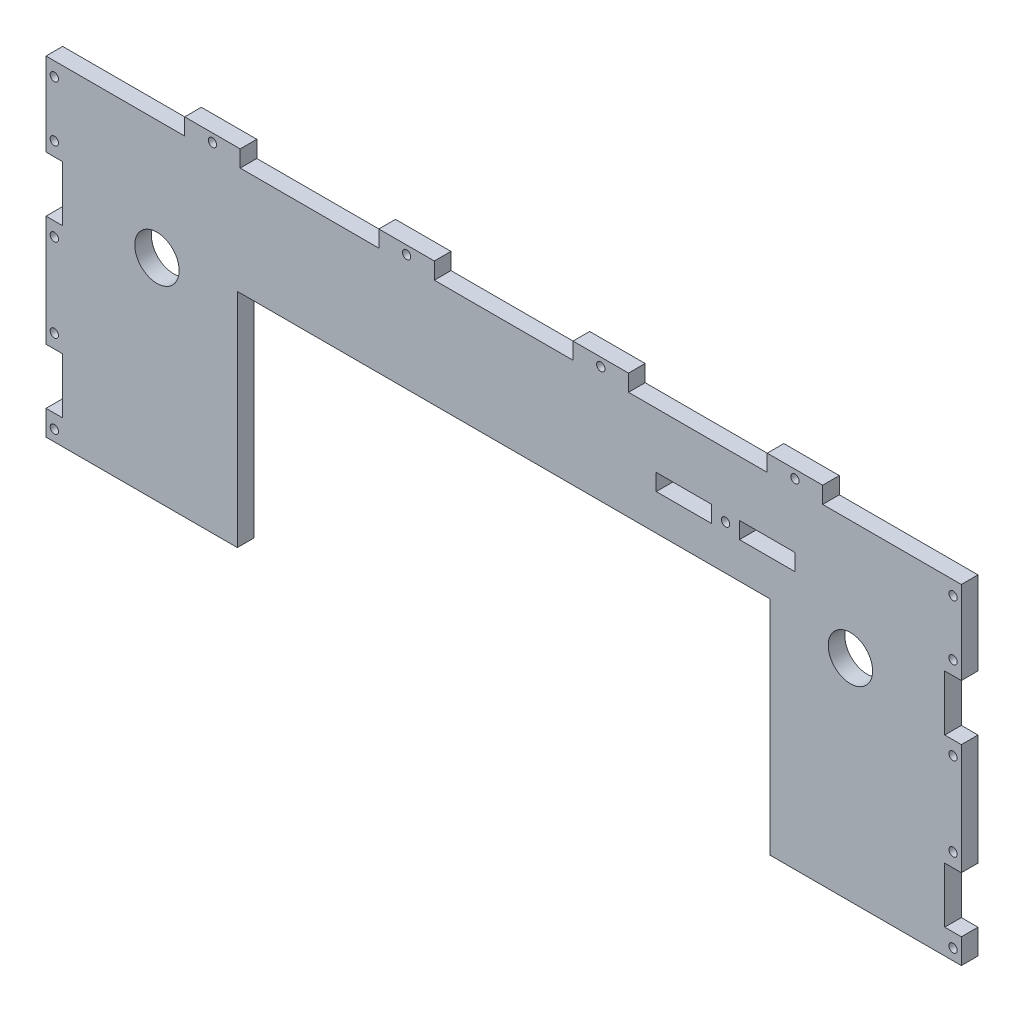
from build123d import *

# Parameters (mm, degrees)
ESQUISSE1_W             = 330
ESQUISSE1_H             = 238
ESQUISSE1_R             = 8
ESQUISSE1_W_2           = 15
ESQUISSE1_H_2           = 6
ESQUISSE1_W_3           = 20
BOSS_EXTRU_1_DEPTH      = 6
ESQUISSE2_W             = 20
ESQUISSE2_H             = 6
BOSS_EXTRU_2_DEPTH      = 6
ESQUISSE3_W             = 6
ESQUISSE3_H             = 20
ESQUISSE3_W_2           = 12
ESQUISSE3_H_2           = 10
ENL_V_MAT_EXTRU_1_DEPTH = 6
ESQUISSE4_R             = 1.5
ENL_V_MAT_EXTRU_2_DEPTH = 6
ESQUISSE5_W             = 423.604058921
ESQUISSE5_H             = 150.356061945
ENL_V_MAT_EXTRU_3_DEPTH = 6
ESQUISSE6_W             = 1.709615384
ESQUISSE6_H             = 19.05
ESQUISSE6_W_2           = 1.709615385
ENL_V_MAT_EXTRU_4_DEPTH = 6
ESQUISSE7_W             = 1.58262541
ESQUISSE7_H             = 1.953846154
ESQUISSE7_W_2           = 1.587980571
ESQUISSE7_H_2           = 1.936817114
ESQUISSE7_W_3           = 0.906225897
ESQUISSE7_W_4           = 1.709615385
ESQUISSE7_H_3           = 0.97063598
ESQUISSE7_W_5           = 1.216684544
ESQUISSE7_W_6           = 1.709615384
ESQUISSE7_H_4           = 3.052884616
ESQUISSE7_H_5           = 2.641773465
ESQUISSE7_W_7           = 1.710749653
ESQUISSE7_H_6           = 0.906659764
ESQUISSE7_W_8           = 1.70801118
ESQUISSE7_H_7           = 1.10546444
BOSS_EXTRU_5_DEPTH      = 6
ESQUISSE8_W             = 192.05
ESQUISSE8_H             = 80
ENL_V_MAT_EXTRU_5_DEPTH = 6


with BuildPart() as part:
    # Esquisse1 → Boss.-Extru.1 (new body)
    with BuildSketch(Plane.XY):
        Rectangle(ESQUISSE1_W, ESQUISSE1_H)
        with Locations((-125, 76)):
            Circle(ESQUISSE1_R, mode=Mode.SUBTRACT)
        with Locations((125, 76)):
            Circle(ESQUISSE1_R, mode=Mode.SUBTRACT)
        with Locations((-85, -58)):
            Rectangle(ESQUISSE1_W_2, ESQUISSE1_H_2, mode=Mode.SUBTRACT)
        with Locations((0, -58)):
            Rectangle(ESQUISSE1_W_2, ESQUISSE1_H_2, mode=Mode.SUBTRACT)
        with Locations((85, -58)):
            Rectangle(ESQUISSE1_W_2, ESQUISSE1_H_2, mode=Mode.SUBTRACT)
        with Locations((65, 96)):
            Rectangle(ESQUISSE1_W_3, ESQUISSE1_H_2, mode=Mode.SUBTRACT)
        with Locations((95, 96)):
            Rectangle(ESQUISSE1_W_3, ESQUISSE1_H_2, mode=Mode.SUBTRACT)
    extrude(amount=BOSS_EXTRU_1_DEPTH)

    # Esquisse2 → Boss.-Extru.2 (add)
    with BuildSketch(Plane.XY.offset(6)):
        with Locations((-105, 122)):
            Rectangle(ESQUISSE2_W, ESQUISSE2_H)
        with Locations((105, 122)):
            Rectangle(ESQUISSE2_W, ESQUISSE2_H)
        with Locations((35, 122)):
            Rectangle(ESQUISSE2_W, ESQUISSE2_H)
        with Locations((-35, 122)):
            Rectangle(ESQUISSE2_W, ESQUISSE2_H)
        with Locations((105, -122)):
            Rectangle(ESQUISSE2_W, ESQUISSE2_H)
        with Locations((-105, -122)):
            Rectangle(ESQUISSE2_W, ESQUISSE2_H)
        with Locations((-35, -122)):
            Rectangle(ESQUISSE2_W, ESQUISSE2_H)
        with Locations((35, -122)):
            Rectangle(ESQUISSE2_W, ESQUISSE2_H)
    extrude(amount=-BOSS_EXTRU_2_DEPTH)

    # Esquisse3 → Enlèv. mat.-Extru.1 (cut)
    with BuildSketch(Plane.XY.offset(6)):
        with Locations((-162, 79)):
            Rectangle(ESQUISSE3_W, ESQUISSE3_H)
        with Locations((-162, 19)):
            Rectangle(ESQUISSE3_W, ESQUISSE3_H)
        with Locations((-162, -19)):
            Rectangle(ESQUISSE3_W, ESQUISSE3_H)
        with Locations((-162, -79)):
            Rectangle(ESQUISSE3_W, ESQUISSE3_H)
        with Locations((162, -79)):
            Rectangle(ESQUISSE3_W, ESQUISSE3_H)
        with Locations((162, -19)):
            Rectangle(ESQUISSE3_W, ESQUISSE3_H)
        with Locations((162, 19)):
            Rectangle(ESQUISSE3_W, ESQUISSE3_H)
        with Locations((162, 79)):
            Rectangle(ESQUISSE3_W, ESQUISSE3_H)
        with Locations((159, -114)):
            Rectangle(ESQUISSE3_W_2, ESQUISSE3_H_2)
        with Locations((-159, -114)):
            Rectangle(ESQUISSE3_W_2, ESQUISSE3_H_2)
    extrude(amount=-ENL_V_MAT_EXTRU_1_DEPTH, mode=Mode.SUBTRACT)

    # Esquisse4 → Enlèv. mat.-Extru.2 (cut)
    with BuildSketch(Plane.XY.offset(6)):
        with Locations((-162, 114)):
            Circle(ESQUISSE4_R)
        with Locations((-162, 94)):
            Circle(ESQUISSE4_R)
        with Locations((-162, 64)):
            Circle(ESQUISSE4_R)
        with Locations((-162, 34)):
            Circle(ESQUISSE4_R)
        with Locations((-162, 4)):
            Circle(ESQUISSE4_R)
        with Locations((-105, 122)):
            Circle(ESQUISSE4_R)
        with Locations((-162, -4)):
            Circle(ESQUISSE4_R)
        with Locations((-162, -34)):
            Circle(ESQUISSE4_R)
        with Locations((-162, -64)):
            Circle(ESQUISSE4_R)
        with Locations((-162, -94)):
            Circle(ESQUISSE4_R)
        with Locations((-97.5, -58)):
            Circle(ESQUISSE4_R)
        with Locations((-72.5, -58)):
            Circle(ESQUISSE4_R)
        with Locations((162, -94)):
            Circle(ESQUISSE4_R)
        with Locations((162, -64)):
            Circle(ESQUISSE4_R)
        with Locations((162, -34)):
            Circle(ESQUISSE4_R)
        with Locations((162, -4)):
            Circle(ESQUISSE4_R)
        with Locations((80, 96)):
            Circle(ESQUISSE4_R)
        with Locations((162, 4)):
            Circle(ESQUISSE4_R)
        with Locations((162, 34)):
            Circle(ESQUISSE4_R)
        with Locations((162, 64)):
            Circle(ESQUISSE4_R)
        with Locations((162, 94)):
            Circle(ESQUISSE4_R)
        with Locations((162, 114)):
            Circle(ESQUISSE4_R)
        with Locations((-12.5, -58)):
            Circle(ESQUISSE4_R)
        with Locations((12.5, -58)):
            Circle(ESQUISSE4_R)
        with Locations((72.5, -58)):
            Circle(ESQUISSE4_R)
        with Locations((97.5, -58)):
            Circle(ESQUISSE4_R)
        with Locations((-35, 122)):
            Circle(ESQUISSE4_R)
        with Locations((35, 122)):
            Circle(ESQUISSE4_R)
        with Locations((105, 122)):
            Circle(ESQUISSE4_R)
    extrude(amount=-ENL_V_MAT_EXTRU_2_DEPTH, mode=Mode.SUBTRACT)

    # Esquisse5 → Enlèv. mat.-Extru.3 (cut)
    with BuildSketch(Plane.XY.offset(6)):
        with Locations((11.705214191, -75.178030973)):
            Rectangle(ESQUISSE5_W, ESQUISSE5_H)
    extrude(amount=-ENL_V_MAT_EXTRU_3_DEPTH, mode=Mode.SUBTRACT)

    # Esquisse6 → Enlèv. mat.-Extru.4 (cut)
    # profile 1 of 11: a face of its own
    with BuildSketch(Plane.XY.offset(6)):
        with BuildLine():
            Line((-81.011538462, 33.174909856), (-79.401141827, 34.140384615))
            add(Edge.make_bspline(
                [(-79.401141827, 34.140384615), (-79.251363993, 33.889662749), (-78.964395442, 33.409289328), (-78.485688759, 32.760184851), (-77.989665343, 32.208485112), (-77.47265197, 31.757399576), (-76.937804452, 31.402259207), (-76.381631246, 31.15078706), (-75.80600659, 30.993945823), (-75.414263362, 30.974895352), (-75.218689904, 30.965384615)],
                knots=[0, 0, 0, 0, 1.272034388, 2.437168799, 3.508375237, 4.49857839, 5.41946034, 6.295179144, 7.148887113, 8, 8, 8, 8], degree=3))
            add(Edge.make_bspline(
                [(-75.218689904, 30.965384615), (-75.051665706, 30.970036476), (-74.720539841, 30.9792588), (-74.233065347, 31.06787288), (-73.759635824, 31.204010324), (-73.31000881, 31.398978537), (-72.890388393, 31.634863724), (-72.522414809, 31.91977649), (-72.204300964, 32.238761695), (-71.944082784, 32.594630144), (-71.744438591, 32.977356339), (-71.59099319, 33.370199731), (-71.50583929, 33.77933151), (-71.493011817, 34.054797029), (-71.486538462, 34.193810096)],
                knots=[0, 0, 0, 0, 1.095163259, 2.171163733, 3.241058638, 4.321873601, 5.38011039, 6.391990106, 7.366004449, 8.327778327, 9.272591725, 10.192022065, 11.087607919, 12, 12, 12, 12], degree=3))
            add(Edge.make_bspline(
                [(-71.486538462, 34.193810096), (-71.494562924, 34.352419578), (-71.510875484, 34.674849478), (-71.648751111, 35.150553303), (-71.865644869, 35.621320006), (-72.065738687, 35.912519751), (-72.169621394, 36.063701923)],
                knots=[0, 0, 0, 0, 0.938893495, 1.908633276, 2.914225137, 4, 4, 4, 4], degree=3))
            add(Edge.make_bspline(
                [(-72.169621394, 36.063701923), (-72.254914309, 36.17281392), (-72.433976113, 36.401880909), (-72.741810575, 36.742849977), (-73.103031854, 37.0945588), (-73.505278346, 37.470437381), (-73.963202729, 37.853003818), (-74.462462486, 38.260501159), (-75.015804347, 38.6774326), (-75.403877322, 38.957046135), (-75.604116587, 39.101322115)],
                knots=[0, 0, 0, 0, 0.722233717, 1.516239348, 2.393582979, 3.351407094, 4.387010283, 5.505090956, 6.712668013, 8, 8, 8, 8], degree=3))
            add(Edge.make_bspline(
                [(-75.604116587, 39.101322115), (-75.804544337, 39.244080571), (-76.187746934, 39.517023867), (-76.723642932, 39.922104613), (-77.202856367, 40.292457674), (-77.623257299, 40.631569511), (-77.984660819, 40.939486117), (-78.289914814, 41.213250614), (-78.531243246, 41.460266853), (-78.665440049, 41.62051187), (-78.725691106, 41.692457933)],
                knots=[0, 0, 0, 0, 1.452282411, 2.77665338, 3.964542531, 5.026858415, 5.96415736, 6.766646006, 7.446254459, 8, 8, 8, 8], degree=3))
            add(Edge.make_bspline(
                [(-78.725691106, 41.692457933), (-78.809905959, 41.804586433), (-78.97552577, 42.025102178), (-79.1941436, 42.369770333), (-79.379958186, 42.722594106), (-79.525621737, 43.084521597), (-79.648283157, 43.45047171), (-79.730785608, 43.825219204), (-79.782445925, 44.207082542), (-79.787736309, 44.464058881), (-79.790384615, 44.592698317)],
                knots=[0, 0, 0, 0, 1.068054152, 2.10047183, 3.106115577, 4.101338837, 5.06977816, 6.043150881, 7.020423561, 8, 8, 8, 8], degree=3))
            add(Edge.make_bspline(
                [(-79.790384615, 44.592698317), (-79.783280549, 44.79424609), (-79.769224262, 45.193033694), (-79.650349446, 45.775587214), (-79.462718411, 46.331773285), (-79.199856235, 46.85608553), (-78.860998357, 47.334871798), (-78.468862411, 47.773639491), (-78.00180275, 48.142494203), (-77.489343472, 48.464776978), (-76.928422361, 48.717031228), (-76.340643301, 48.907318848), (-75.725072095, 49.015137808), (-75.308132177, 49.030610571), (-75.096574519, 49.038461538)],
                knots=[0, 0, 0, 0, 1.005424448, 1.989358655, 2.955360095, 3.929531133, 4.905563448, 5.876582895, 6.856512386, 7.866279853, 8.892233794, 9.918561126, 10.94386622, 12, 12, 12, 12], degree=3))
            add(Edge.make_bspline(
                [(-75.096574519, 49.038461538), (-74.872088773, 49.030718793), (-74.425658273, 49.015320944), (-73.768981828, 48.881440095), (-73.136735643, 48.659912153), (-72.628137302, 48.408513886), (-72.230086129, 48.157427181), (-71.926523112, 47.92871928), (-71.618906702, 47.665420475), (-71.304755575, 47.366829435), (-70.989392843, 47.030206404), (-70.668136624, 46.657856798), (-70.340235675, 46.252056115), (-70.129293065, 45.962362761), (-70.021153846, 45.813852163)],
                knots=[0, 0, 0, 0, 1.286793592, 2.559021753, 3.825965368, 5.121522368, 5.803751409, 6.523245864, 7.299691795, 8.125521123, 9.008227632, 9.944561021, 10.946284179, 12, 12, 12, 12], degree=3))
            Line((-70.021153846, 45.813852163), (-71.566676683, 44.642307692))
            add(Edge.make_bspline(
                [(-71.566676683, 44.642307692), (-71.659999544, 44.762533279), (-71.839717554, 44.994059648), (-72.11256519, 45.318297809), (-72.369732831, 45.614478933), (-72.623100007, 45.871736273), (-72.859285344, 46.104157885), (-73.088522388, 46.303147418), (-73.307512214, 46.470654588), (-73.583557113, 46.649417392), (-73.930363552, 46.82661779), (-74.365707956, 46.976563487), (-74.82065611, 47.066670324), (-75.130515962, 47.078584126), (-75.287379808, 47.084615385)],
                knots=[0, 0, 0, 0, 1.181633172, 2.275549214, 3.290209073, 4.226197932, 5.078386478, 5.862611352, 6.581680152, 7.217281963, 8.414376989, 9.595101626, 10.782541182, 12, 12, 12, 12], degree=3))
            add(Edge.make_bspline(
                [(-75.287379808, 47.084615385), (-75.484174594, 47.078020275), (-75.863674801, 47.065302227), (-76.402464514, 46.926400593), (-76.887390021, 46.707696467), (-77.304054696, 46.401182087), (-77.650965957, 46.038029255), (-77.901911383, 45.620132915), (-78.052951564, 45.15867441), (-78.0713826, 44.836774823), (-78.080769231, 44.672836538)],
                knots=[0, 0, 0, 0, 1.14458467, 2.207223713, 3.21896685, 4.227309161, 5.202851033, 6.127160689, 7.046193047, 8, 8, 8, 8], degree=3))
            add(Edge.make_bspline(
                [(-78.080769231, 44.672836538), (-78.078629499, 44.57077492), (-78.074346536, 44.366484791), (-78.01461228, 44.064670623), (-77.937871646, 43.763618904), (-77.816263893, 43.464683132), (-77.648377312, 43.162635263), (-77.427913426, 42.852274092), (-77.150255256, 42.530864077), (-76.937564661, 42.321818229), (-76.825270433, 42.211448317)],
                knots=[0, 0, 0, 0, 0.858281714, 1.717966888, 2.583508476, 3.4729293, 4.427298488, 5.488583878, 6.674047936, 8, 8, 8, 8], degree=3))
            add(Edge.make_bspline(
                [(-76.825270433, 42.211448317), (-76.783570677, 42.174235363), (-76.684501603, 42.0858259), (-76.503385493, 41.941087915), (-76.26421112, 41.762547112), (-75.973223996, 41.541636147), (-75.625058785, 41.285378474), (-75.2196772, 40.997050671), (-74.761598, 40.667292672), (-74.436540144, 40.43674663), (-74.264663462, 40.31484375)],
                knots=[0, 0, 0, 0, 0.420754252, 0.999615792, 1.744751191, 2.668019286, 3.750313428, 4.999500688, 6.413464383, 8, 8, 8, 8], degree=3))
            add(Edge.make_bspline(
                [(-74.264663462, 40.31484375), (-74.057911562, 40.164395779), (-73.657565164, 39.873074134), (-73.087928907, 39.435383076), (-72.571435466, 39.007314507), (-72.106271458, 38.591602102), (-71.687841428, 38.191399196), (-71.320787548, 37.801891029), (-71.001369774, 37.425868126), (-70.657494313, 36.94378025), (-70.306115324, 36.351700348), (-70.004355119, 35.626285936), (-69.814081828, 34.898051677), (-69.789199723, 34.408592753), (-69.776923077, 34.167097356)],
                knots=[0, 0, 0, 0, 1.163667725, 2.253281268, 3.268753668, 4.215851969, 5.092017293, 5.902905408, 6.650798638, 7.335211899, 8.59617414, 9.77448103, 10.901945474, 12, 12, 12, 12], degree=3))
            add(Edge.make_bspline(
                [(-69.776923077, 34.167097356), (-69.780499786, 33.996309397), (-69.787583746, 33.658050067), (-69.869013863, 33.16136172), (-69.988319469, 32.678956558), (-70.168136414, 32.216797503), (-70.387609604, 31.76642958), (-70.666100181, 31.339666579), (-70.988903437, 30.927063181), (-71.3592015, 30.539621607), (-71.764399911, 30.183951597), (-72.192664021, 29.86756342), (-72.644694792, 29.60375726), (-73.11804003, 29.388487677), (-73.612808463, 29.22012096), (-74.128833686, 29.098130915), (-74.666966312, 29.023260545), (-75.032728933, 29.015489444), (-75.218689904, 29.011538462)],
                knots=[0, 0, 0, 0, 0.983748083, 1.948392443, 2.894712957, 3.844097841, 4.80183111, 5.778335162, 6.776009319, 7.81870978, 8.863265674, 9.881300176, 10.883814829, 11.87499822, 12.874611388, 13.892143829, 14.928324115, 16, 16, 16, 16], degree=3))
            add(Edge.make_bspline(
                [(-75.218689904, 29.011538462), (-75.362573699, 29.01432075), (-75.648529222, 29.019850287), (-76.07149083, 29.068734113), (-76.485907737, 29.137897063), (-76.886579758, 29.247701643), (-77.278669098, 29.380926333), (-77.660470475, 29.544964972), (-78.032168925, 29.741545739), (-78.395847483, 29.966308659), (-78.750581205, 30.227880098), (-79.093042881, 30.532535842), (-79.434468876, 30.87187352), (-79.764781705, 31.255108157), (-80.090662676, 31.676048294), (-80.40568659, 32.138632278), (-80.716374225, 32.640340446), (-80.9113127, 32.993391841), (-81.011538462, 33.174909856)],
                knots=[0, 0, 0, 0, 0.915332311, 1.819136955, 2.706846663, 3.586547465, 4.459518054, 5.340707479, 6.227863349, 7.133153174, 8.059268498, 9.028702269, 10.047606654, 11.120612155, 12.245963614, 13.433783089, 14.680604001, 16, 16, 16, 16], degree=3))
        make_face()
    # profile 2 of 11: a face of its own
    with BuildSketch(Plane.XY.offset(6)):
        with BuildLine():
            Line((-65.869230769, 48.55), (-64.159615385, 48.55))
            Line((-64.159615385, 48.55), (-64.159615385, 37.136027644))
            add(Edge.make_bspline(
                [(-64.159615385, 37.136027644), (-64.159869805, 36.97447964), (-64.160352613, 36.667914462), (-64.157127644, 36.231569854), (-64.148095939, 35.843644041), (-64.142401842, 35.502641707), (-64.129734498, 35.21012761), (-64.1194037, 34.96451699), (-64.106120098, 34.766972831), (-64.090155559, 34.651688077), (-64.083293269, 34.602133413)],
                knots=[0, 0, 0, 0, 1.528628734, 2.90083645, 4.128790002, 5.200304208, 6.127813768, 6.898992206, 7.526736466, 8, 8, 8, 8], degree=3))
            add(Edge.make_bspline(
                [(-64.083293269, 34.602133413), (-64.055113101, 34.423353173), (-64.000340615, 34.075866319), (-63.860751044, 33.581065527), (-63.665801503, 33.135124305), (-63.434790085, 32.724127134), (-63.130356872, 32.359513618), (-62.765666201, 32.023625907), (-62.323827204, 31.729865085), (-61.832551622, 31.461255666), (-61.303041972, 31.245364289), (-60.761960651, 31.082114692), (-60.217441007, 30.982625252), (-59.852899308, 30.971105233), (-59.671875, 30.965384615)],
                knots=[0, 0, 0, 0, 1.035780045, 2.013197591, 2.933192213, 3.817615948, 4.702609284, 5.640816605, 6.646850145, 7.73207398, 8.84249596, 9.914020372, 10.964143139, 12, 12, 12, 12], degree=3))
            add(Edge.make_bspline(
                [(-59.671875, 30.965384615), (-59.51646107, 30.971229429), (-59.20653084, 30.982885298), (-58.746030125, 31.055065373), (-58.297538105, 31.185152738), (-57.858840118, 31.353009137), (-57.447626903, 31.574792454), (-57.063669026, 31.830992309), (-56.720965327, 32.13149722), (-56.408229653, 32.464057667), (-56.135896645, 32.839287149), (-55.899833717, 33.249015301), (-55.706471157, 33.699408174), (-55.610984258, 34.015934387), (-55.561929087, 34.178545673)],
                knots=[0, 0, 0, 0, 0.994687771, 1.983630487, 2.973142513, 3.978332533, 4.983357753, 5.956394766, 6.925816176, 7.893390482, 8.871859704, 9.88551698, 10.913711441, 12, 12, 12, 12], degree=3))
            add(Edge.make_bspline(
                [(-55.561929087, 34.178545673), (-55.545599833, 34.245757199), (-55.509211676, 34.395531565), (-55.475209903, 34.648740304), (-55.439795814, 34.947495271), (-55.415223655, 35.293942995), (-55.391268441, 35.686922574), (-55.376937002, 36.128481204), (-55.370312865, 36.617015519), (-55.368338848, 36.957940643), (-55.367307692, 37.136027644)],
                knots=[0, 0, 0, 0, 0.558680831, 1.244966039, 2.062412453, 2.990489873, 4.051219941, 5.244515665, 6.560634259, 8, 8, 8, 8], degree=3))
            Line((-55.367307692, 37.136027644), (-55.367307692, 48.55))
            Line((-55.367307692, 48.55), (-53.657692308, 48.55))
            Line((-53.657692308, 48.55), (-53.657692308, 37.044441106))
            add(Edge.make_bspline(
                [(-53.657692308, 37.044441106), (-53.659075449, 36.837077072), (-53.661774732, 36.432393552), (-53.685182156, 35.839386869), (-53.722503826, 35.276851356), (-53.775234705, 34.744711397), (-53.84510468, 34.244871187), (-53.922802666, 33.77294952), (-54.021751267, 33.332333946), (-54.137321636, 32.91958893), (-54.269439091, 32.526693493), (-54.440568769, 32.15381089), (-54.633379262, 31.789605372), (-54.862059016, 31.439585522), (-55.119023827, 31.102201569), (-55.409953689, 30.779499603), (-55.725226622, 30.466322794), (-56.070083654, 30.170704534), (-56.438840084, 29.899603022), (-56.830398996, 29.66121801), (-57.241752557, 29.45970375), (-57.671831487, 29.293827647), (-58.12081932, 29.169106757), (-58.588727377, 29.076169123), (-59.076620701, 29.023360904), (-59.408442616, 29.015512684), (-59.576472356, 29.011538462)],
                knots=[0, 0, 0, 0, 1.316592851, 2.569410997, 3.76748051, 4.895814652, 5.963796859, 6.97159953, 7.931736103, 8.829262218, 9.692595152, 10.560224239, 11.431080259, 12.30701507, 13.211635791, 14.121146779, 15.063487852, 16.031507147, 17.00238618, 17.966455255, 18.938106653, 19.907068911, 20.888905087, 21.893141452, 22.933117798, 24, 24, 24, 24], degree=3))
            add(Edge.make_bspline(
                [(-59.576472356, 29.011538462), (-59.759728471, 29.015809827), (-60.119276315, 29.02419023), (-60.649073509, 29.072211199), (-61.156969349, 29.162662745), (-61.648328051, 29.277833296), (-62.116460014, 29.436676209), (-62.56763719, 29.622267431), (-62.994132297, 29.850199376), (-63.402864355, 30.103800558), (-63.782910527, 30.389140375), (-64.131783536, 30.700146179), (-64.450059346, 31.031835947), (-64.73237325, 31.387800795), (-64.983402636, 31.765272229), (-65.199648512, 32.165318091), (-65.385322026, 32.587783498), (-65.481152056, 32.88144306), (-65.529597356, 33.029897837)],
                knots=[0, 0, 0, 0, 1.13879206, 2.234305948, 3.301075583, 4.341971843, 5.366689343, 6.369221514, 7.369726634, 8.367512178, 9.355451585, 10.318319045, 11.268648973, 12.207971039, 13.137398894, 14.081662264, 15.030215811, 16, 16, 16, 16], degree=3))
            add(Edge.make_bspline(
                [(-65.529597356, 33.029897837), (-65.557775888, 33.131312277), (-65.618895752, 33.351282458), (-65.68434773, 33.71533606), (-65.739370017, 34.134517255), (-65.791107412, 34.608854735), (-65.821636169, 35.138716152), (-65.848401085, 35.723871822), (-65.869419325, 36.3650293), (-65.869295378, 36.811640306), (-65.869230769, 37.044441106)],
                knots=[0, 0, 0, 0, 0.625038921, 1.35572334, 2.194682327, 3.136881307, 4.189498639, 5.346923369, 6.617055217, 8, 8, 8, 8], degree=3))
            Line((-65.869230769, 37.044441106), (-65.869230769, 48.55))
        make_face()
    # profile 3 of 11: a face of its own
    with BuildSketch(Plane.XY.offset(6)):
        with BuildLine():
            Line((-48.773076923, 29.5), (-48.773076923, 48.55))
            Line((-48.773076923, 48.55), (-44.926442308, 48.55))
            add(Edge.make_bspline(
                [(-44.926442308, 48.55), (-44.591875386, 48.547591155), (-43.945493835, 48.542937278), (-43.0114318, 48.513429421), (-42.147194464, 48.461229885), (-41.355624188, 48.38519575), (-40.634547877, 48.291834239), (-39.985984596, 48.174810609), (-39.406580789, 48.036626425), (-39.050239977, 47.918813331), (-38.881730769, 47.863100962)],
                knots=[0, 0, 0, 0, 1.314313732, 2.53924729, 3.670748893, 4.714932338, 5.66265055, 6.526160246, 7.303039223, 8, 8, 8, 8], degree=3))
            add(Edge.make_bspline(
                [(-38.881730769, 47.863100962), (-38.661323688, 47.779113835), (-38.225507627, 47.613044132), (-37.604983146, 47.299773406), (-37.020826527, 46.944827809), (-36.469905182, 46.547739471), (-35.964803541, 46.097264945), (-35.485789132, 45.612539951), (-35.052457563, 45.075937699), (-34.655628124, 44.498586693), (-34.29783832, 43.887288237), (-33.986838047, 43.243207146), (-33.72855274, 42.569614342), (-33.514141035, 41.868383036), (-33.345159602, 41.137971323), (-33.229869374, 40.377528709), (-33.153827272, 39.59006055), (-33.146185221, 39.055710968), (-33.142307692, 38.784585337)],
                knots=[0, 0, 0, 0, 0.984719456, 1.947108742, 2.898477687, 3.838006223, 4.779231079, 5.722358779, 6.681677486, 7.655904652, 8.64651281, 9.637519902, 10.640069247, 11.656948941, 12.698408672, 13.768548281, 14.867775369, 16, 16, 16, 16], degree=3))
            add(Edge.make_bspline(
                [(-33.142307692, 38.784585337), (-33.145731072, 38.549120596), (-33.152477201, 38.08511273), (-33.213052477, 37.401267284), (-33.301097876, 36.737709131), (-33.437409867, 36.097598107), (-33.602886405, 35.47532595), (-33.814962714, 34.877524734), (-34.057907343, 34.298710572), (-34.341207396, 33.746709738), (-34.652219792, 33.223741669), (-34.98598528, 32.730752009), (-35.342147865, 32.274775444), (-35.72410381, 31.854431142), (-36.126917238, 31.470352779), (-36.55322538, 31.119331953), (-37.00412827, 30.80823699), (-37.477606347, 30.524843158), (-37.987472136, 30.277626652), (-38.543383065, 30.068457598), (-39.147709905, 29.895121021), (-39.798969299, 29.750499431), (-40.498286514, 29.635778683), (-41.246347171, 29.558890747), (-42.042001933, 29.506895499), (-42.588351934, 29.50234313), (-42.869561298, 29.5)],
                knots=[0, 0, 0, 0, 1.105936401, 2.179363191, 3.223086493, 4.248585256, 5.251745608, 6.245858792, 7.225916811, 8.198733463, 9.158002045, 10.082870192, 10.993790845, 11.873723703, 12.748670949, 13.606408763, 14.465103618, 15.319838547, 16.196477973, 17.123216899, 18.106603292, 19.147568657, 20.255746949, 21.433717677, 22.679120308, 24, 24, 24, 24], degree=3))
            Line((-42.869561298, 29.5), (-48.773076923, 29.5))
        make_face()
        with BuildLine():
            Line((-47.063461538, 31.453846154), (-44.876832933, 31.453846154))
            add(Edge.make_bspline(
                [(-44.876832933, 31.453846154), (-44.562625658, 31.455196507), (-43.958289998, 31.457793731), (-43.089294327, 31.480584079), (-42.295293612, 31.517823767), (-41.576175111, 31.569939548), (-40.93234485, 31.638893011), (-40.362457297, 31.715772839), (-39.868380534, 31.811553249), (-39.569407455, 31.898372042), (-39.43125, 31.938491587)],
                knots=[0, 0, 0, 0, 1.375205317, 2.645023457, 3.804390687, 4.853969522, 5.800190428, 6.637939096, 7.370582563, 8, 8, 8, 8], degree=3))
            add(Edge.make_bspline(
                [(-39.43125, 31.938491587), (-39.257359629, 31.999732211), (-38.913732256, 32.120750728), (-38.419079492, 32.341500284), (-37.957759224, 32.602986406), (-37.5217318, 32.893647355), (-37.117182433, 33.22373488), (-36.739316886, 33.586071262), (-36.388895938, 33.982500538), (-36.069540062, 34.412530674), (-35.783744864, 34.873485133), (-35.536251458, 35.360832214), (-35.319345265, 35.869232138), (-35.149100354, 36.406491987), (-35.015665531, 36.967808719), (-34.921152016, 37.553221823), (-34.862289015, 38.162621971), (-34.855423134, 38.577107105), (-34.851923077, 38.788401442)],
                knots=[0, 0, 0, 0, 0.998632004, 1.973411704, 2.929992603, 3.868527914, 4.809262121, 5.754881198, 6.702106254, 7.672490631, 8.653608572, 9.636854334, 10.631411391, 11.644891563, 12.686317036, 13.754757253, 14.855430412, 16, 16, 16, 16], degree=3))
            add(Edge.make_bspline(
                [(-34.851923077, 38.788401442), (-34.854716827, 39.011196528), (-34.860205173, 39.448879446), (-34.929189634, 40.091085944), (-35.029999815, 40.708744914), (-35.175779591, 41.301897663), (-35.361549089, 41.871701408), (-35.593385639, 42.415004742), (-35.858271096, 42.937545529), (-36.173430686, 43.427263148), (-36.518592701, 43.890412785), (-36.901649445, 44.314710254), (-37.316515112, 44.701122088), (-37.758664792, 45.055666061), (-38.240559575, 45.364078354), (-38.750847521, 45.639958718), (-39.297014674, 45.87408807), (-39.676995204, 45.998614451), (-39.870102163, 46.061899038)],
                knots=[0, 0, 0, 0, 1.122418816, 2.205001699, 3.251619955, 4.274784885, 5.280384055, 6.268708349, 7.249350384, 8.229342522, 9.199999885, 10.157847722, 11.105861043, 12.055065948, 13.010012805, 13.98527497, 14.976112212, 16, 16, 16, 16], degree=3))
            add(Edge.make_bspline(
                [(-39.870102163, 46.061899038), (-40.02985626, 46.106075596), (-40.369537302, 46.200007078), (-40.923834956, 46.302470891), (-41.54766884, 46.392846807), (-42.243808642, 46.469362707), (-43.011460827, 46.524266556), (-43.851215786, 46.56547614), (-44.763436491, 46.593270811), (-45.395801425, 46.595168774), (-45.724008413, 46.596153846)],
                knots=[0, 0, 0, 0, 0.674548936, 1.434276114, 2.292660221, 3.240891867, 4.284742987, 5.42552168, 6.663806718, 8, 8, 8, 8], degree=3))
            Line((-45.724008413, 46.596153846), (-47.063461538, 46.596153846))
            Line((-47.063461538, 46.596153846), (-47.063461538, 31.453846154))
        make_face(mode=Mode.SUBTRACT)
    # profile 4 of 11: a face of its own
    with BuildSketch(Plane.XY.offset(6)):
        with BuildLine():
            Line((-29.234615385, 48.55), (-25.422325721, 48.55))
            add(Edge.make_bspline(
                [(-25.422325721, 48.55), (-25.167920436, 48.549153168), (-24.679434107, 48.547527156), (-23.979628164, 48.538460646), (-23.343754965, 48.51247451), (-22.772146982, 48.490112077), (-22.264814703, 48.449334511), (-21.820202449, 48.410360132), (-21.440357981, 48.359340635), (-21.210419848, 48.311958262), (-21.106310096, 48.290504808)],
                knots=[0, 0, 0, 0, 1.410062039, 2.707475311, 3.878576406, 4.937260626, 5.877586885, 6.699081471, 7.410979367, 8, 8, 8, 8], degree=3))
            add(Edge.make_bspline(
                [(-21.106310096, 48.290504808), (-20.966936899, 48.256069128), (-20.691163714, 48.187932374), (-20.294106925, 48.043916547), (-19.915750391, 47.877258304), (-19.557665776, 47.681512912), (-19.221646684, 47.455227326), (-18.904228449, 47.202307973), (-18.603970713, 46.924138753), (-18.333016411, 46.613706259), (-18.077533858, 46.288024685), (-17.86205862, 45.93585138), (-17.676313066, 45.567579351), (-17.528427824, 45.179463263), (-17.409349139, 44.775267048), (-17.325386322, 44.351329454), (-17.27503343, 43.909581861), (-17.269907044, 43.608276672), (-17.267307692, 43.455498798)],
                knots=[0, 0, 0, 0, 1.027469482, 2.033020251, 3.019912614, 3.986113645, 4.951240523, 5.91722682, 6.890402269, 7.87763091, 8.8651537, 9.85103654, 10.82876324, 11.815024772, 12.821070561, 13.842952187, 14.906261191, 16, 16, 16, 16], degree=3))
            add(Edge.make_bspline(
                [(-17.267307692, 43.455498798), (-17.275303239, 43.201670586), (-17.290904622, 42.706386001), (-17.436365543, 41.987597489), (-17.674634887, 41.317095648), (-18.002965931, 40.695724719), (-18.421083363, 40.135596777), (-18.923594012, 39.643614442), (-19.510778211, 39.231917204), (-20.057400631, 38.946424081), (-20.540259347, 38.763582678), (-20.937769235, 38.634933354), (-21.371385212, 38.535536085), (-21.836952705, 38.446490225), (-22.336409173, 38.379261717), (-22.86855753, 38.330022396), (-23.433777298, 38.299248217), (-23.822065661, 38.294665304), (-24.021814904, 38.292307692)],
                knots=[0, 0, 0, 0, 1.260483769, 2.459530307, 3.627416485, 4.787058657, 5.939039949, 7.08810263, 8.267026773, 9.491475466, 10.141966685, 10.831826277, 11.566392101, 12.351337768, 13.187381173, 14.07005841, 15.007169909, 16, 16, 16, 16], degree=3))
            Line((-24.021814904, 38.292307692), (-17.023076923, 29.5))
            Line((-17.023076923, 29.5), (-19.137199519, 29.5))
            Line((-19.137199519, 29.5), (-26.1359375, 38.292307692))
            Line((-26.1359375, 38.292307692), (-27.525, 38.292307692))
            Line((-27.525, 38.292307692), (-27.525, 29.5))
            Line((-27.525, 29.5), (-29.234615385, 29.5))
            Line((-29.234615385, 29.5), (-29.234615385, 48.55))
        make_face()
        with BuildLine():
            Line((-27.525, 46.596153846), (-27.525, 40.246153846))
            Line((-27.525, 40.246153846), (-24.037079327, 40.219441106))
            add(Edge.make_bspline(
                [(-24.037079327, 40.219441106), (-23.874228829, 40.219369061), (-23.558578183, 40.219229416), (-23.10191885, 40.24096697), (-22.676722242, 40.265695602), (-22.28461472, 40.303519897), (-21.925421117, 40.352266516), (-21.599320968, 40.413242759), (-21.305781957, 40.484283271), (-20.963434197, 40.594237835), (-20.581146791, 40.76844202), (-20.165685559, 41.021891377), (-19.811887121, 41.340674726), (-19.512977042, 41.705201679), (-19.272786851, 42.105993262), (-19.103448384, 42.538245214), (-18.99599309, 42.991045198), (-18.98331915, 43.302257471), (-18.976923077, 43.459314904)],
                knots=[0, 0, 0, 0, 1.146690395, 2.22261258, 3.21895312, 4.145990853, 4.996080663, 5.770904154, 6.481378293, 7.121626537, 8.300444488, 9.431385265, 10.535395872, 11.636531494, 12.74115979, 13.810798291, 14.895190096, 16, 16, 16, 16], degree=3))
            add(Edge.make_bspline(
                [(-18.976923077, 43.459314904), (-18.98346605, 43.612512684), (-18.996431836, 43.916094783), (-19.102288705, 44.360536237), (-19.281300909, 44.780000637), (-19.522540518, 45.17278162), (-19.816450204, 45.529319982), (-20.161080014, 45.83437663), (-20.547006861, 46.086105859), (-20.907711527, 46.24696613), (-21.230114883, 46.345589903), (-21.510039176, 46.414992666), (-21.826331647, 46.470751846), (-22.180528072, 46.515427149), (-22.571116377, 46.553826203), (-23.000071492, 46.579689455), (-23.464547396, 46.595004916), (-23.786475693, 46.595761957), (-23.953125, 46.596153846)],
                knots=[0, 0, 0, 0, 1.101028733, 2.181837193, 3.264309656, 4.369019818, 5.486613113, 6.575447106, 7.666700264, 8.788928104, 9.402425223, 10.0903467, 10.862060571, 11.710948788, 12.657782767, 13.684531032, 14.801375019, 16, 16, 16, 16], degree=3))
            Line((-23.953125, 46.596153846), (-27.525, 46.596153846))
        make_face(mode=Mode.SUBTRACT)
    # profile 5 of 11: a face of its own
    with BuildSketch(Plane.XY.offset(6)):
        with Locations((-12.260576923, 39.025)):
            Rectangle(ESQUISSE6_W, ESQUISSE6_H)
    # profile 6 of 11: a face of its own
    with BuildSketch(Plane.XY.offset(6)):
        Polygon((1.294230769, 48.55), (10.086538462, 29.5), (8.228094952, 29.5), (5.411808894, 35.605769231), (-3.224038462, 35.605769231), (-6.12046274, 29.5), (-7.986538462, 29.5), (1.05, 48.55), align=None)
        Polygon((1.153034856, 44.836929087), (-2.29672476, 37.559615385), (4.511207933, 37.559615385), align=None, mode=Mode.SUBTRACT)
    # profile 7 of 11: a face of its own
    with BuildSketch(Plane.XY.offset(6)):
        with BuildLine():
            Line((13.505769231, 48.55), (17.22265625, 48.55))
            add(Edge.make_bspline(
                [(17.22265625, 48.55), (17.404602681, 48.549043416), (17.757260148, 48.547189317), (18.270083109, 48.518433989), (18.750408779, 48.479225443), (19.198376454, 48.417013082), (19.613779134, 48.341946409), (19.997868703, 48.25104081), (20.349423783, 48.142038813), (20.769137391, 47.968704053), (21.247676988, 47.711130809), (21.76582824, 47.330519618), (22.208899886, 46.86497864), (22.590913984, 46.33983733), (22.894631506, 45.762155487), (23.114355825, 45.145701902), (23.253463689, 44.49842785), (23.267769881, 44.054055696), (23.275, 43.829477163)],
                knots=[0, 0, 0, 0, 1.001505555, 1.941167018, 2.826882275, 3.653841531, 4.429895133, 5.150066043, 5.825578002, 6.45369114, 7.647487171, 8.808567382, 9.977351308, 11.170798116, 12.373658725, 13.556498008, 14.765093433, 16, 16, 16, 16], degree=3))
            add(Edge.make_bspline(
                [(23.275, 43.829477163), (23.269049768, 43.619096825), (23.257357002, 43.205679619), (23.145545697, 42.601010253), (22.970499773, 42.025421476), (22.727175489, 41.481013921), (22.410934623, 40.980088113), (22.036148632, 40.518603136), (21.583973464, 40.116098097), (21.245192401, 39.891074585), (21.073106971, 39.776772837)],
                knots=[0, 0, 0, 0, 1.044552857, 2.05264487, 3.044412934, 4.028983338, 5.005914585, 5.980388656, 6.974128949, 8, 8, 8, 8], degree=3))
            add(Edge.make_bspline(
                [(21.073106971, 39.776772837), (21.289517298, 39.693687628), (21.703563864, 39.534725042), (22.273354874, 39.253680588), (22.76427253, 38.947998245), (23.180091282, 38.614177746), (23.535714804, 38.254356933), (23.846245814, 37.863259811), (24.111211579, 37.435784572), (24.338249063, 36.976388187), (24.515407293, 36.489761552), (24.648081858, 35.980469185), (24.724104688, 35.45033732), (24.734923136, 35.089555469), (24.740384615, 34.907421875)],
                knots=[0, 0, 0, 0, 1.27268992, 2.434971085, 3.483601985, 4.442670788, 5.356604649, 6.2567628, 7.179492994, 8.113709626, 9.066344395, 10.018646069, 10.999752585, 12, 12, 12, 12], degree=3))
            add(Edge.make_bspline(
                [(24.740384615, 34.907421875), (24.735067782, 34.721456471), (24.724606763, 34.355564329), (24.647427203, 33.818054239), (24.516749063, 33.304384887), (24.336747538, 32.811233821), (24.101821226, 32.339555089), (23.81591902, 31.888814324), (23.475024366, 31.463540324), (23.09368218, 31.059007461), (22.662269645, 30.695273362), (22.196819607, 30.371337873), (21.691470352, 30.104931449), (21.154521642, 29.881142817), (20.57995015, 29.710197923), (19.970335958, 29.590604342), (19.32620483, 29.510022641), (18.884191756, 29.503397568), (18.657512019, 29.5)],
                knots=[0, 0, 0, 0, 0.978564426, 1.925352924, 2.850884081, 3.763762016, 4.682927383, 5.618979971, 6.567305752, 7.547517671, 8.540179244, 9.531824382, 10.526200242, 11.540722885, 12.589160233, 13.674978461, 14.80764778, 16, 16, 16, 16], degree=3))
            Line((18.657512019, 29.5), (13.505769231, 29.5))
            Line((13.505769231, 29.5), (13.505769231, 48.55))
        make_face()
        with BuildLine():
            Line((15.215384615, 46.596153846), (15.215384615, 40.490384615))
            Line((15.215384615, 40.490384615), (16.364032452, 40.490384615))
            add(Edge.make_bspline(
                [(16.364032452, 40.490384615), (16.531938038, 40.492561339), (16.856365848, 40.496767213), (17.326192713, 40.50881507), (17.762301741, 40.542550135), (18.163940147, 40.576275504), (18.530475449, 40.631110046), (18.861095609, 40.696381458), (19.160989401, 40.765412698), (19.50682607, 40.882812334), (19.899108833, 41.056317966), (20.317300443, 41.325586103), (20.685969484, 41.646302939), (20.997285606, 42.016368031), (21.252073753, 42.423853986), (21.429041259, 42.862259149), (21.549041478, 43.320657296), (21.559881098, 43.635353787), (21.565384615, 43.795132212)],
                knots=[0, 0, 0, 0, 1.156816544, 2.235205308, 3.236616184, 4.169592532, 5.011045266, 5.787822928, 6.49130361, 7.128639758, 8.301311294, 9.436451833, 10.541879658, 11.654887649, 12.756523258, 13.837046038, 14.901820046, 16, 16, 16, 16], degree=3))
            add(Edge.make_bspline(
                [(21.565384615, 43.795132212), (21.562520692, 43.900863911), (21.556902793, 44.108268185), (21.510892675, 44.410615384), (21.432692019, 44.694970665), (21.332247938, 44.965230894), (21.191883789, 45.212945393), (21.026619796, 45.446679073), (20.826944824, 45.658472175), (20.599665737, 45.856426159), (20.338361661, 46.031928517), (20.043188487, 46.185638957), (19.710152702, 46.309413755), (19.34486702, 46.417814528), (18.941708672, 46.493950813), (18.505330031, 46.557378537), (18.032156775, 46.589669604), (17.704795574, 46.593944222), (17.535576923, 46.596153846)],
                knots=[0, 0, 0, 0, 0.91205012, 1.789085906, 2.630437955, 3.453916878, 4.269457761, 5.079663411, 5.91843418, 6.774407191, 7.675494373, 8.627863946, 9.638891023, 10.736472738, 11.911756761, 13.175263542, 14.539845004, 16, 16, 16, 16], degree=3))
            Line((17.535576923, 46.596153846), (15.215384615, 46.596153846))
        make_face(mode=Mode.SUBTRACT)
        with BuildLine():
            Line((15.215384615, 38.536538462), (15.215384615, 31.453846154))
            Line((15.215384615, 31.453846154), (17.650060096, 31.453846154))
            add(Edge.make_bspline(
                [(17.650060096, 31.453846154), (17.824334536, 31.455934836), (18.160225543, 31.459960496), (18.64519081, 31.473102571), (19.094678846, 31.502996243), (19.506638557, 31.550054368), (19.885518306, 31.601099927), (20.226772947, 31.669741327), (20.533168757, 31.748384955), (20.888447489, 31.869946664), (21.288516584, 32.058794599), (21.719649959, 32.34353346), (22.102969804, 32.682750321), (22.428481286, 33.075348582), (22.695251981, 33.50223909), (22.889319529, 33.954787352), (23.009012621, 34.425515723), (23.023502428, 34.746463115), (23.030769231, 34.907421875)],
                knots=[0, 0, 0, 0, 1.160039823, 2.235823828, 3.228722157, 4.157150951, 4.99529583, 5.772374946, 6.472645482, 7.099169577, 8.269452708, 9.405989375, 10.527446681, 11.663510218, 12.788923519, 13.866172445, 14.929861265, 16, 16, 16, 16], degree=3))
            add(Edge.make_bspline(
                [(23.030769231, 34.907421875), (23.029266434, 35.008078486), (23.026285082, 35.207768106), (22.981323735, 35.501224208), (22.915933958, 35.785482176), (22.831398582, 36.061313877), (22.708284054, 36.323732397), (22.564557002, 36.577927757), (22.396038516, 36.824235981), (22.133452413, 37.135634103), (21.751516326, 37.494410988), (21.208826591, 37.845679393), (20.591757369, 38.128968171), (20.144204872, 38.249252464), (19.913010817, 38.311388221)],
                knots=[0, 0, 0, 0, 0.723448775, 1.435228256, 2.130040452, 2.821711965, 3.505591119, 4.210454504, 4.921174351, 5.648778258, 7.137944449, 8.670945889, 10.280296675, 12, 12, 12, 12], degree=3))
            add(Edge.make_bspline(
                [(19.913010817, 38.311388221), (19.820323881, 38.33019375), (19.619359486, 38.370968014), (19.291658227, 38.414008514), (18.917538712, 38.452353768), (18.496137051, 38.480717355), (18.026920087, 38.510035542), (17.508885716, 38.521437354), (16.944149475, 38.53504047), (16.552305276, 38.536026358), (16.348768029, 38.536538462)],
                knots=[0, 0, 0, 0, 0.634451884, 1.375622551, 2.216452059, 3.157844607, 4.20941857, 5.370758133, 6.634282058, 8, 8, 8, 8], degree=3))
            Line((16.348768029, 38.536538462), (15.215384615, 38.536538462))
        make_face(mode=Mode.SUBTRACT)
    # profile 8 of 11: a face of its own
    with BuildSketch(Plane.XY.offset(6)):
        with BuildLine():
            add(Edge.make_bspline(
                [(37.5625, 49.038461538), (37.915241262, 49.029527201), (38.608054204, 49.011979424), (39.626276147, 48.877654589), (40.598343737, 48.645269681), (41.532175493, 48.335772591), (42.416601551, 47.922908007), (43.258278951, 47.423878843), (44.055205079, 46.833456974), (44.796638598, 46.156206468), (45.475128571, 45.419333669), (46.07289518, 44.632961044), (46.573868236, 43.801843278), (46.985270878, 42.928477899), (47.308024739, 42.014840074), (47.530741248, 41.056059002), (47.673007465, 40.058346874), (47.689639625, 39.37784351), (47.698076923, 39.032632212)],
                knots=[0, 0, 0, 0, 1.065120563, 2.091984664, 3.0946048, 4.079830382, 5.057816894, 6.036188127, 7.030412546, 8.04752943, 9.064399622, 10.05169764, 11.02544977, 11.989514704, 12.962713494, 13.945757189, 14.957906945, 16, 16, 16, 16], degree=3))
            add(Edge.make_bspline(
                [(47.698076923, 39.032632212), (47.689640862, 38.689963825), (47.673012408, 38.014524737), (47.53057949, 37.02314399), (47.30719919, 36.070150342), (46.988268084, 35.157134718), (46.578826551, 34.283133978), (46.074517691, 33.450447843), (45.480477673, 32.658803331), (44.804437526, 31.916872967), (44.067468998, 31.236529591), (43.277001403, 30.643699711), (42.450812047, 30.133572689), (41.578269207, 29.726535835), (40.670944721, 29.401205811), (39.720718077, 29.179395068), (38.732041833, 29.036318447), (38.057829655, 29.019889096), (37.715144231, 29.011538462)],
                knots=[0, 0, 0, 0, 1.043624062, 2.057103931, 3.04512605, 4.022047818, 4.998200453, 5.980619268, 6.982898556, 8.009068085, 9.034988726, 10.034168286, 11.015286542, 11.987931943, 12.962482838, 13.94673481, 14.956375938, 16, 16, 16, 16], degree=3))
            add(Edge.make_bspline(
                [(37.715144231, 29.011538462), (37.369934723, 29.019971553), (36.689434891, 29.036595421), (35.690469027, 29.179097067), (34.731014449, 29.401934735), (33.813814909, 29.720393237), (32.938358935, 30.131967022), (32.102934342, 30.633822285), (31.310894412, 31.229309725), (30.568805764, 31.905130652), (29.889813699, 32.6408501), (29.297851954, 33.429162259), (28.795883838, 34.254601245), (28.385691985, 35.119457769), (28.060946856, 36.019550907), (27.839396346, 36.960884763), (27.696053521, 37.938092645), (27.679535286, 38.603443277), (27.671153846, 38.941045673)],
                knots=[0, 0, 0, 0, 1.053102029, 2.075944431, 3.073151272, 4.055350789, 5.033113405, 6.020478099, 7.024410459, 8.052272461, 9.079885166, 10.07527673, 11.055994387, 12.023226415, 12.992069828, 13.970394897, 14.97016774, 16, 16, 16, 16], degree=3))
            add(Edge.make_bspline(
                [(27.671153846, 38.941045673), (27.674063791, 39.167646344), (27.67984697, 39.617989016), (27.749470325, 40.286734368), (27.850499013, 40.944724948), (27.995289422, 41.590089679), (28.184655496, 42.221248753), (28.408095816, 42.842555048), (28.680999832, 43.447712173), (28.989504502, 44.039586919), (29.333829485, 44.608952807), (29.714153207, 45.147140252), (30.117117141, 45.658665392), (30.558877898, 46.130272656), (31.024875978, 46.575681557), (31.522670865, 46.988047202), (32.049225081, 47.371088007), (32.606804319, 47.716275863), (33.181669501, 48.028473439), (33.774270249, 48.296380942), (34.376558159, 48.52632022), (34.991354172, 48.71268814), (35.617025688, 48.85981965), (36.254938259, 48.960008247), (36.904583679, 49.029809177), (37.342251, 49.035565009), (37.5625, 49.038461538)],
                knots=[0, 0, 0, 0, 1.037015668, 2.060948919, 3.074880161, 4.083647147, 5.086022904, 6.090072063, 7.104153813, 8.122640571, 9.144368836, 10.147691507, 11.138137339, 12.123020368, 13.103399296, 14.087645067, 15.080126199, 16.082011238, 17.087798457, 18.072939717, 19.057185487, 20.037253025, 21.01195951, 21.997135196, 22.992090687, 24, 24, 24, 24], degree=3))
        make_face()
        with BuildLine():
            add(Edge.make_bspline(
                [(37.646454327, 47.084615385), (37.465671821, 47.082411625), (37.105835104, 47.078025173), (36.570886414, 47.02024535), (36.042973174, 46.937895526), (35.52198636, 46.820430391), (35.010105842, 46.660388333), (34.502560278, 46.476197104), (34.003977941, 46.251836596), (33.516004801, 45.99834802), (33.042938463, 45.717774608), (32.596555045, 45.407685419), (32.17569894, 45.075352431), (31.781400589, 44.720000059), (31.41481778, 44.339818655), (31.068735334, 43.940571824), (30.757025182, 43.51084796), (30.471353686, 43.062299888), (30.215714441, 42.595511853), (29.988391582, 42.115398174), (29.802441762, 41.618042479), (29.650790828, 41.108840564), (29.525061858, 40.588598891), (29.4454115, 40.053370914), (29.3869968, 39.50584609), (29.38286107, 39.13583057), (29.380769231, 38.948677885)],
                knots=[0, 0, 0, 0, 1.008559885, 2.007477868, 2.99961109, 3.989939068, 4.984837346, 5.991145699, 7.001802488, 8.033829008, 9.059044045, 10.069351652, 11.065060232, 12.050310815, 13.029377138, 14.011219647, 14.996725999, 15.989392538, 16.977580475, 17.965360261, 18.951710183, 19.937753436, 20.929683414, 21.935841486, 22.955955122, 24, 24, 24, 24], degree=3))
            add(Edge.make_bspline(
                [(29.380769231, 38.948677885), (29.387708122, 38.67347494), (29.401359069, 38.132065611), (29.520870986, 37.338670428), (29.704959161, 36.576189898), (29.976325684, 35.848796077), (30.315691172, 35.150236481), (30.734937532, 34.486708082), (31.231647698, 33.858031552), (31.795873464, 33.268595874), (32.412672767, 32.730592282), (33.067626626, 32.258351444), (33.753718404, 31.858789941), (34.472737264, 31.533279476), (35.220844584, 31.275343903), (36.002860969, 31.098567353), (36.813577042, 30.982223803), (37.366193893, 30.971050946), (37.646454327, 30.965384615)],
                knots=[0, 0, 0, 0, 1.032063989, 2.030389145, 3.003944642, 3.970395727, 4.937377036, 5.913328081, 6.909231446, 7.93887556, 8.970685674, 9.976071282, 10.964166581, 11.944589148, 12.933237628, 13.927779006, 14.949070134, 16, 16, 16, 16], degree=3))
            add(Edge.make_bspline(
                [(37.646454327, 30.965384615), (37.8348289, 30.967972718), (38.208432255, 30.973105702), (38.764123598, 31.024805643), (39.309803836, 31.107710532), (39.844707588, 31.227075958), (40.368227776, 31.376467181), (40.88254949, 31.553946386), (41.38219447, 31.775368366), (41.873465873, 32.020013646), (42.343708274, 32.298906503), (42.792610814, 32.598471289), (43.208858648, 32.930314782), (43.602862022, 33.280387447), (43.970949872, 33.655747819), (44.310633058, 34.055907884), (44.620767777, 34.483393461), (44.906330796, 34.931261169), (45.161074269, 35.399326488), (45.38302908, 35.881180878), (45.571330796, 36.37563783), (45.723341658, 36.883410526), (45.842461099, 37.403534575), (45.924538949, 37.9367064), (45.981952594, 38.481859393), (45.986280085, 38.850579523), (45.988461538, 39.036448317)],
                knots=[0, 0, 0, 0, 1.047197238, 2.076906641, 3.100256066, 4.114471768, 5.12198147, 6.126382909, 7.136867548, 8.15857795, 9.17633901, 10.174870724, 11.156907918, 12.133735059, 13.104061851, 14.077631395, 15.04955518, 16.038496417, 17.029181396, 18.010275684, 18.986308667, 19.968651475, 20.955262928, 21.950658345, 22.966943676, 24, 24, 24, 24], degree=3))
            add(Edge.make_bspline(
                [(45.988461538, 39.036448317), (45.986278338, 39.221045562), (45.981947557, 39.587228201), (45.924566374, 40.128579226), (45.842374385, 40.657914563), (45.723923074, 41.173156119), (45.571250094, 41.674435234), (45.382996196, 42.161281104), (45.161007638, 42.635507423), (44.906237159, 43.095942097), (44.619856748, 43.537764599), (44.306923796, 43.960143445), (43.962035258, 44.355146508), (43.595045037, 44.732525343), (43.196786361, 45.084231285), (42.769063275, 45.410381004), (42.3170684, 45.71884554), (41.838493018, 45.997114669), (41.344586642, 46.254094993), (40.83778067, 46.474264025), (40.323816571, 46.66134656), (39.804001331, 46.820914613), (39.273959692, 46.937435463), (38.737273138, 47.020319563), (38.194684188, 47.078005063), (37.82977752, 47.082404952), (37.646454327, 47.084615385)],
                knots=[0, 0, 0, 0, 1.02996197, 2.043119294, 3.035359645, 4.018872909, 4.991431989, 5.957985074, 6.929999688, 7.912076566, 8.892894881, 9.867085534, 10.843653904, 11.817741046, 12.803660682, 13.806313499, 14.818574707, 15.856120519, 16.894564902, 17.924820532, 18.937903209, 19.946497019, 20.957711757, 21.963978472, 22.977135795, 24, 24, 24, 24], degree=3))
        make_face(mode=Mode.SUBTRACT)
    # profile 9 of 11: a face of its own
    with BuildSketch(Plane.XY.offset(6)):
        Polygon((49.407692308, 46.596153846), (49.407692308, 48.55), (59.421153846, 48.55), (59.421153846, 46.596153846), (55.269230769, 46.596153846), (55.269230769, 29.5), (53.559615385, 29.5), (53.559615385, 46.596153846), align=None)
    # profile 10 of 11: a face of its own
    with BuildSketch(Plane.XY.offset(6)):
        with Locations((63.206730769, 39.025)):
            Rectangle(ESQUISSE6_W_2, ESQUISSE6_H)
    # profile 11 of 11: a face of its own
    with BuildSketch(Plane.XY.offset(6)):
        Polygon((68.946153846, 48.55), (70.655769231, 48.55), (70.655769231, 41.295582933), (78.597085337, 48.55), (81.035576923, 48.55), (71.674669471, 40.001923077), (81.768269231, 29.5), (79.490054087, 29.5), (70.655769231, 38.692998798), (70.655769231, 29.5), (68.946153846, 29.5), align=None)
    extrude(amount=-ENL_V_MAT_EXTRU_4_DEPTH, mode=Mode.SUBTRACT)


with BuildPart() as enl_v_mat_extru_4_piece_1:
    # of the separate pieces the step leaves, piece 1, a body of its own (enl_v_mat_extru_4_pieces)
    add(part.part.solids().sort_by_distance((-165, 119, 0))[0])



with BuildPart() as enl_v_mat_extru_4_piece_2:
    # of the separate pieces the step leaves, piece 2, a body of its own (enl_v_mat_extru_4_pieces)
    add(part.part.solids().sort_by_distance((37.646454327, 47.084615385, 0))[0])


with BuildPart() as enl_v_mat_extru_4_piece_3:
    # of the separate pieces the step leaves, piece 3, a body of its own (enl_v_mat_extru_4_pieces)
    add(part.part.solids().sort_by_distance((-47.063461538, 31.453846154, 0))[0])


with BuildPart() as enl_v_mat_extru_4_piece_4:
    # of the separate pieces the step leaves, piece 4, a body of its own (enl_v_mat_extru_4_pieces)
    add(part.part.solids().sort_by_distance((-27.525, 46.596153846, 0))[0])


with BuildPart() as enl_v_mat_extru_4_piece_5:
    # of the separate pieces the step leaves, piece 5, a body of its own (enl_v_mat_extru_4_pieces)
    add(part.part.solids().sort_by_distance((15.215384615, 38.536538462, 0))[0])


with BuildPart() as enl_v_mat_extru_4_piece_6:
    # of the separate pieces the step leaves, piece 6, a body of its own (enl_v_mat_extru_4_pieces)
    add(part.part.solids().sort_by_distance((15.215384615, 46.596153846, 0))[0])


with BuildPart() as enl_v_mat_extru_4_piece_7:
    # of the separate pieces the step leaves, piece 7, a body of its own (enl_v_mat_extru_4_pieces)
    add(part.part.solids().sort_by_distance((1.153034856, 44.836929087, 0))[0])


with BuildPart() as enl_v_mat_extru_4_piece_1_1:
    add(enl_v_mat_extru_4_piece_1.part)

    add(enl_v_mat_extru_4_piece_2.part)  # Boss.-Extru.5 merges Enlèv. mat.-Extru.4 piece 2

    add(enl_v_mat_extru_4_piece_3.part)  # Boss.-Extru.5 merges Enlèv. mat.-Extru.4 piece 3

    add(enl_v_mat_extru_4_piece_4.part)  # Boss.-Extru.5 merges Enlèv. mat.-Extru.4 piece 4

    add(enl_v_mat_extru_4_piece_5.part)  # Boss.-Extru.5 merges Enlèv. mat.-Extru.4 piece 5

    add(enl_v_mat_extru_4_piece_6.part)  # Boss.-Extru.5 merges Enlèv. mat.-Extru.4 piece 6

    add(enl_v_mat_extru_4_piece_7.part)  # Boss.-Extru.5 merges Enlèv. mat.-Extru.4 piece 7
    # Esquisse7 → Boss.-Extru.5 (add)
    with BuildSketch(Plane.XY.offset(6)):
        with Locations((-45.178834531, 30.476923077)):
            Rectangle(ESQUISSE7_W, ESQUISSE7_H)
        with Locations((-44.384844246, 47.562132152)):
            Rectangle(ESQUISSE7_W_2, ESQUISSE7_H_2)
        with Locations((-25.875438669, 47.573076923)):
            Rectangle(ESQUISSE7_W_3, ESQUISSE7_H)
        with Locations((-28.379807693, 42.935835856)):
            Rectangle(ESQUISSE7_W_4, ESQUISSE7_H_3)
        with Locations((1.279551333, 36.582692308)):
            Rectangle(ESQUISSE7_W_5, ESQUISSE7_H)
        with Locations((14.360576923, 42.016826923)):
            Rectangle(ESQUISSE7_W_6, ESQUISSE7_H_4)
        with Locations((14.360576923, 34.284882499)):
            Rectangle(ESQUISSE7_W_6, ESQUISSE7_H_5)
        with Locations((28.537557324, 38.999545465)):
            Rectangle(ESQUISSE7_W_7, ESQUISSE7_H_6)
        with Locations((46.827350298, 39.034548512)):
            Rectangle(ESQUISSE7_W_8, ESQUISSE7_H_7)
    extrude(amount=-BOSS_EXTRU_5_DEPTH)

    # Esquisse8 → Enlèv. mat.-Extru.5 (cut)
    with BuildSketch(Plane.XY.offset(6)):
        with Locations((0.010576923, 40)):
            Rectangle(ESQUISSE8_W, ESQUISSE8_H)
    extrude(amount=-ENL_V_MAT_EXTRU_5_DEPTH, mode=Mode.SUBTRACT)


solid = enl_v_mat_extru_4_piece_1_1.part
